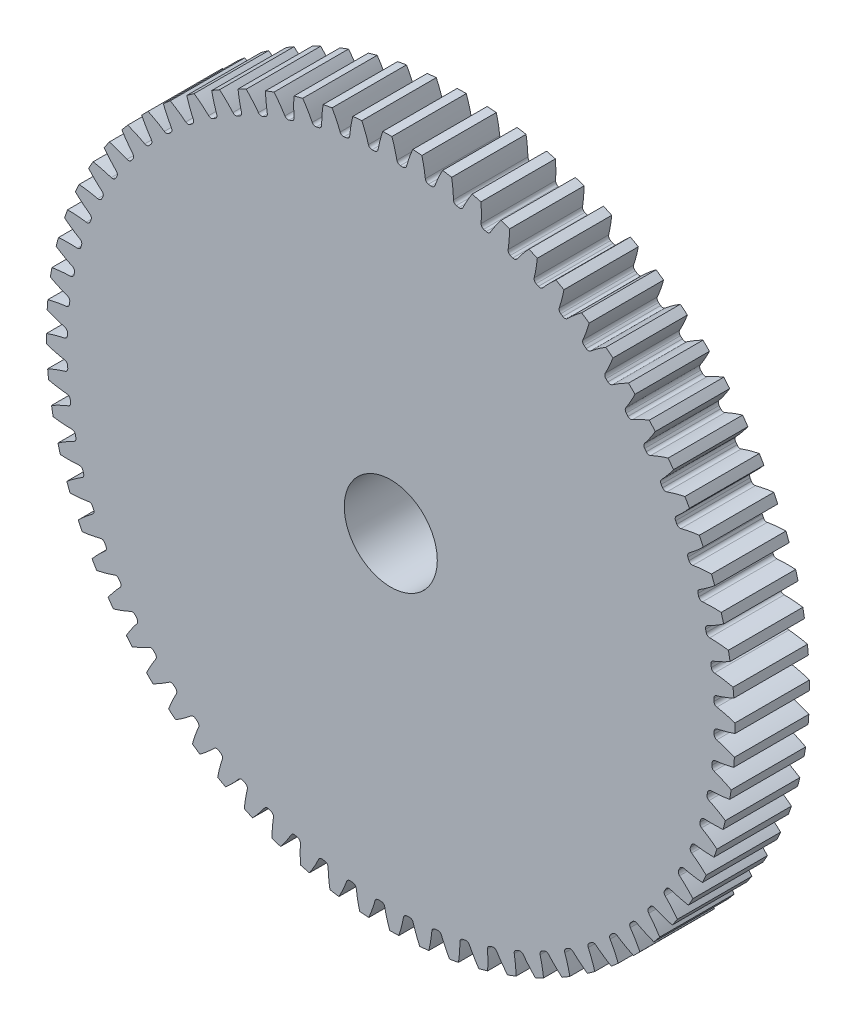
from build123d import *

# Parameters (mm, degrees)
SKETCH3_R         = 58.7375
GEARBODY_DEPTH    = 12.7
TOOTHCUT_DEPTH    = 85.032599701
CIRPATTERN1_COUNT = 72
BOREDIA_R         = 7.9375
BORE_DEPTH        = 12700


with BuildPart() as part:
    # Sketch3 → gearBody (new body)
    with BuildSketch(Plane.XY):
        Circle(SKETCH3_R)
    extrude(amount=GEARBODY_DEPTH)

    # Sketch2 → toothCut (cut, through all)
    with BuildSketch(Plane.XY):
        with BuildLine():
            ThreePointArc((55.155207878, -2.074308927), (55.163166629, -1.850611018), (55.170218111, -1.626882672))
            ThreePointArc((55.170218111, -1.626882672), (55.314138272, -1.249546852), (55.661224905, -1.04308571))
            ThreePointArc((55.661224905, -1.04308571), (63.677054078, 2.292609672), (69.851849866, 8.396074096))
            ThreePointArc((69.851849866, 8.396074096), (70.315079856, -2.358926608), (69.132086235, -13.058699889))
            ThreePointArc((69.132086235, -13.058699889), (63.38023088, -6.555120798), (55.605984349, -2.689700785))
            ThreePointArc((55.605984349, -2.689700785), (55.273515227, -2.460441943), (55.155207878, -2.074308927))
        make_face()
    toothcut = extrude(amount=TOOTHCUT_DEPTH, mode=Mode.SUBTRACT)

    # CirPattern1: toothCut ×72 about axis
    cirpattern1_axis = Axis((0, 0, 12.7), (0, 0, -1))
    for i in range(1, CIRPATTERN1_COUNT):
        add(toothcut.rotate(cirpattern1_axis, i * 360 / CIRPATTERN1_COUNT), mode=Mode.SUBTRACT)

    # boreDia → bore (cut, symmetric)
    with BuildSketch(Plane.XY):
        Circle(BOREDIA_R)
    extrude(amount=BORE_DEPTH, both=True, mode=Mode.SUBTRACT)


solid = part.part
